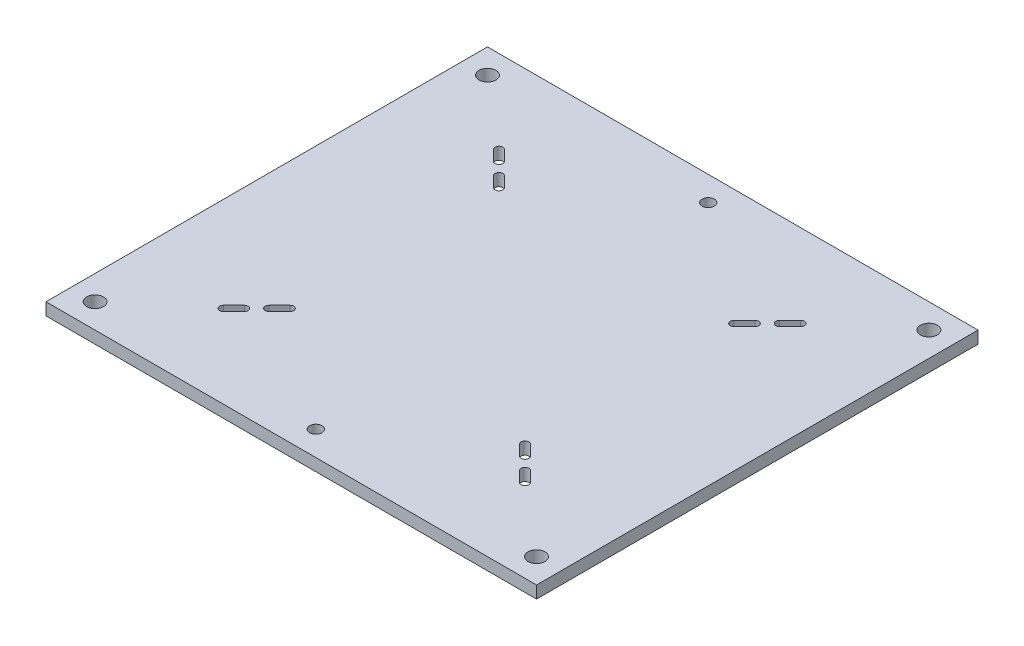
from build123d import *

# Parameters (mm, degrees)
SKETCH1_W                            = 254
SKETCH1_H                            = 228.6
BASE_PLATE_DEPTH                     = 6.35
SLOTS_DEPTH                          = 342.781044676
FEET_CONNECTION_HOLE_D               = 8.7376
HOLE_FOR_10_BLIND_FASTENERS_B_BS_1_D = 6.35


with BuildPart() as part:
    # Sketch1 → base plate (new body)
    with BuildSketch(Plane(origin=(0, 0, 0), x_dir=(1, 0, 0), z_dir=(0, 1, 0))):
        with Locations((127, -114.3)):
            Rectangle(SKETCH1_W, SKETCH1_H)
    extrude(amount=-BASE_PLATE_DEPTH)

    # Sketch3 → slots (cut, through all)
    with BuildSketch(Plane(origin=(0, 0, 0), x_dir=(1, 0, 0), z_dir=(0, 1, 0))):
        with BuildLine():
            Line((52.89618524, -178.825387544), (47.508031568, -184.213541217))
            ThreePointArc((47.508031568, -184.213541217), (47.508031568, -187.041968432), (50.336458783, -187.041968432))
            Line((50.336458783, -187.041968432), (55.724612456, -181.65381476))
            ThreePointArc((55.724612456, -181.65381476), (55.724612456, -178.825387544), (52.89618524, -178.825387544))
        make_face()
        with BuildLine():
            Line((62.145142119, -175.233285096), (67.533295792, -169.845131423))
            ThreePointArc((67.533295792, -169.845131423), (67.533295792, -167.016704208), (64.704868577, -167.016704208))
            Line((64.704868577, -167.016704208), (59.316714904, -172.404857881))
            ThreePointArc((59.316714904, -172.404857881), (59.316714904, -175.233285096), (62.145142119, -175.233285096))
        make_face()
        with BuildLine():
            ThreePointArc((50.336458783, -41.558031568), (47.508031568, -41.558031568), (47.508031568, -44.386458783))
            Line((47.508031568, -44.386458783), (52.89618524, -49.774612456))
            ThreePointArc((52.89618524, -49.774612456), (55.724612456, -49.774612456), (55.724612456, -46.94618524))
            Line((55.724612456, -46.94618524), (50.336458783, -41.558031568))
        make_face()
        with BuildLine():
            ThreePointArc((64.704868577, -61.583295792), (67.533295792, -61.583295792), (67.533295792, -58.754868577))
            Line((67.533295792, -58.754868577), (62.145142119, -53.366714904))
            ThreePointArc((62.145142119, -53.366714904), (59.316714904, -53.366714904), (59.316714904, -56.195142119))
            Line((59.316714904, -56.195142119), (64.704868577, -61.583295792))
        make_face()
        with BuildLine():
            Line((201.10381476, -49.774612456), (206.491968432, -44.386458783))
            ThreePointArc((206.491968432, -44.386458783), (206.491968432, -41.558031568), (203.663541217, -41.558031568))
            Line((203.663541217, -41.558031568), (198.275387544, -46.94618524))
            ThreePointArc((198.275387544, -46.94618524), (198.275387544, -49.774612456), (201.10381476, -49.774612456))
        make_face()
        with BuildLine():
            Line((191.854857881, -53.366714904), (186.466704208, -58.754868577))
            ThreePointArc((186.466704208, -58.754868577), (186.466704208, -61.583295792), (189.295131423, -61.583295792))
            Line((189.295131423, -61.583295792), (194.683285096, -56.195142119))
            ThreePointArc((194.683285096, -56.195142119), (194.683285096, -53.366714904), (191.854857881, -53.366714904))
        make_face()
        with BuildLine():
            ThreePointArc((189.295131423, -167.016704208), (186.466704208, -167.016704208), (186.466704208, -169.845131423))
            Line((186.466704208, -169.845131423), (191.854857881, -175.233285096))
            ThreePointArc((191.854857881, -175.233285096), (194.683285096, -175.233285096), (194.683285096, -172.404857881))
            Line((194.683285096, -172.404857881), (189.295131423, -167.016704208))
        make_face()
        with BuildLine():
            ThreePointArc((203.663541217, -187.041968432), (206.491968432, -187.041968432), (206.491968432, -184.213541217))
            Line((206.491968432, -184.213541217), (201.10381476, -178.825387544))
            ThreePointArc((201.10381476, -178.825387544), (198.275387544, -178.825387544), (198.275387544, -181.65381476))
            Line((198.275387544, -181.65381476), (203.663541217, -187.041968432))
        make_face()
    extrude(amount=-SLOTS_DEPTH, mode=Mode.SUBTRACT)

    # Feet connection hole (through all)
    with Locations(Plane(origin=(0, 0, 0), x_dir=(1, 0, 0), z_dir=(0, 1, 0))):
        with Locations((12.7, -215.9), (241.3, -12.7), (12.7, -12.7), (241.3, -215.9)):
            Hole(FEET_CONNECTION_HOLE_D / 2)

    # Hole for #10 Blind Fasteners (B,BS)1 (through all)
    with Locations(Plane(origin=(0, 0, 0), x_dir=(1, 0, 0), z_dir=(0, 1, 0))):
        with Locations((127, -215.9), (127, -12.7)):
            Hole(HOLE_FOR_10_BLIND_FASTENERS_B_BS_1_D / 2)


solid = part.part
